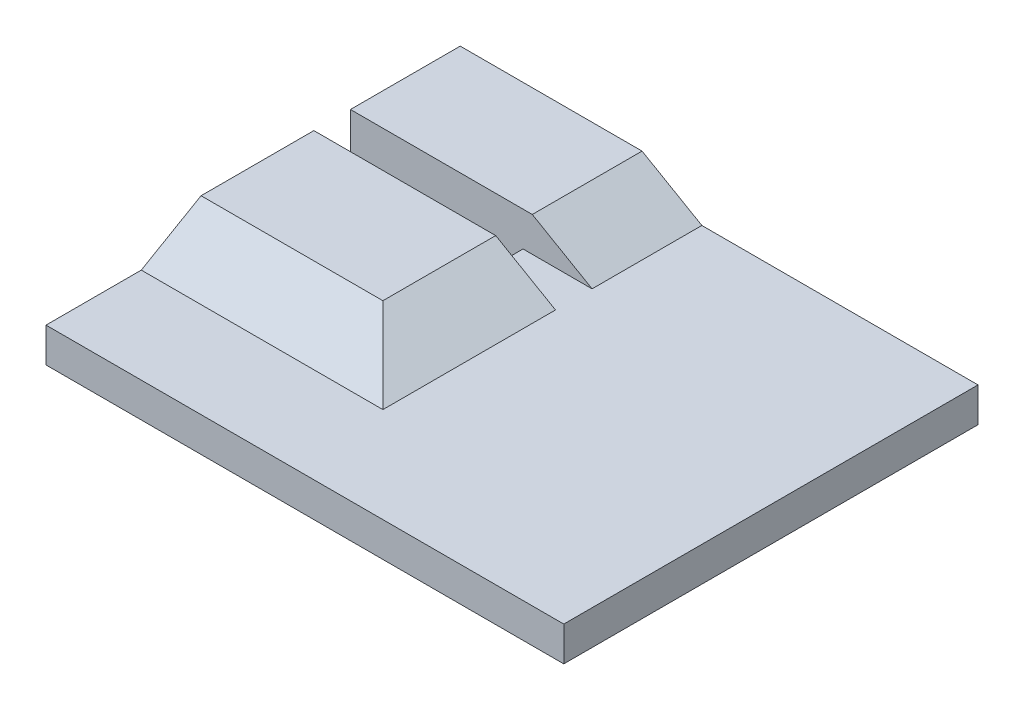
from build123d import *

# Parameters (mm, degrees)
SKETCH1_W           = 37.5
SKETCH1_H           = 40
BOSS_EXTRUDE1_DEPTH = 2.5
SKETCH2_W           = 12.5
SKETCH2_H           = 2.65
CUT_EXTRUDE1_DEPTH  = 28.528394432
SKETCH3_W           = 12.5
SKETCH3_H           = 17.95
SKETCH3_H_2         = 7.5
BOSS_EXTRUDE2_DEPTH = 2.5
SKETCH4_W           = 37.5
SKETCH4_H           = 10
CUT_EXTRUDE2_DEPTH  = 28.866871012


with BuildPart() as part:
    # Sketch1 → Boss-Extrude1 (new body)
    with BuildSketch(Plane(origin=(0, 0, 0), x_dir=(1, 0, 0), z_dir=(0, 1, 0))):
        Rectangle(SKETCH1_W, SKETCH1_H)
    extrude(amount=BOSS_EXTRUDE1_DEPTH)

    # Sketch2 → Cut-Extrude1 (cut, through all)
    with BuildSketch(Plane.XZ):
        with Locations((-12.5, -0.725)):
            Rectangle(SKETCH2_W, SKETCH2_H)
    extrude(amount=-CUT_EXTRUDE1_DEPTH, mode=Mode.SUBTRACT)

    # Sketch3 → Boss-Extrude2 (add)
    with BuildSketch(Plane(origin=(0, 2.5, 0), x_dir=(1, 0, 0), z_dir=(0, 1, 0))):
        with Locations((-12.5, 11.025)):
            Rectangle(SKETCH3_W, SKETCH3_H)
        with Locations((-12.5, -4.35)):
            Rectangle(SKETCH3_W, SKETCH3_H_2)
    extrude(amount=BOSS_EXTRUDE2_DEPTH)

    # Sketch4 → Cut-Extrude2 (cut, through all)
    with BuildSketch(Plane(origin=(0, 5, 0), x_dir=(1, 0, 0), z_dir=(0, 1, 0))):
        with Locations((0, 15)):
            Rectangle(SKETCH4_W, SKETCH4_H)
    extrude(amount=-CUT_EXTRUDE2_DEPTH, mode=Mode.SUBTRACT)

    # Chamfer1
    # the kernel refuses this chamfer: 5, 2.886751346 mm, written as the material it adds along each edge
    with BuildSketch(Plane(origin=(-6.25, 2.5, -2.05), x_dir=(0.9998132206222079, -0.019326765612700723, -1.5830863978385058e-15), z_dir=(0, 0, -1))) as chamfer1_piece_1_section:
        with BuildLine():
            Line((5.174171509, 0), (-0.230896973, -2.982845988))
            Line((-0.230896973, -2.982845988), (-0.330878295, -2.980913312))
            ThreePointArc((-0.330878295, -2.980913312), (-0.128843444, -1.491164065), (-0.099981322, 0.001932677))
            Line((-0.099981322, 0.001932677), (0.001932677, 0.099981322))
            ThreePointArc((0.001932677, 0.099981322), (2.588052093, 0.049990661), (5.176104186, 0.099981322))
            Line((5.176104186, 0.099981322), (5.174171509, 0))
        make_face()
    chamfer1_piece_1 = extrude(amount=7.95, mode=Mode.PRIVATE)
    chamfer1_piece_1 = split(chamfer1_piece_1, bisect_by=Plane(origin=(-6.25, 3.354735535, -6.025), z_dir=(1, 0, 0)), keep=Keep.TOP, mode=Mode.PRIVATE)
    chamfer1_piece_1 = split(chamfer1_piece_1, bisect_by=Plane(origin=(-4.46158964, 5, -6.025), z_dir=(0, -1, 0)), keep=Keep.TOP, mode=Mode.PRIVATE)
    add(chamfer1_piece_1)
    with BuildSketch(Plane(origin=(-6.25, 2.5, 8.1), x_dir=(0, -0.019326765612700723, 0.9998132206222079), z_dir=(-1, 0, 0))) as chamfer1_piece_2_section:
        with BuildLine():
            Line((5.174171509, 0), (-0.230896973, 2.982845988))
            Line((-0.230896973, 2.982845988), (-0.330878295, 2.980913312))
            ThreePointArc((-0.330878295, 2.980913312), (-0.128843444, 1.491164065), (-0.099981322, -0.001932677))
            Line((-0.099981322, -0.001932677), (0.001932677, -0.099981322))
            ThreePointArc((0.001932677, -0.099981322), (2.588052093, -0.049990661), (5.176104186, -0.099981322))
            Line((5.176104186, -0.099981322), (5.174171509, 0))
        make_face()
    chamfer1_piece_2 = extrude(amount=12.5, mode=Mode.PRIVATE)
    chamfer1_piece_2 = split(chamfer1_piece_2, bisect_by=Plane(origin=(-12.5, 5, 9.824344196), z_dir=(0, -1, 0)), keep=Keep.TOP, mode=Mode.PRIVATE)
    add(chamfer1_piece_2)
    with BuildSketch(Plane(origin=(-6.25, 2.5, 0.6), x_dir=(0.9998132206222079, -0.019326765612700723, 0), z_dir=(0, 0, 1))) as chamfer1_piece_3_section:
        with BuildLine():
            Line((5.174171509, 0), (-0.230896973, 2.982845988))
            Line((-0.230896973, 2.982845988), (-0.330878295, 2.980913312))
            ThreePointArc((-0.330878295, 2.980913312), (-0.128843444, 1.491164065), (-0.099981322, -0.001932677))
            Line((-0.099981322, -0.001932677), (0.001932677, -0.099981322))
            ThreePointArc((0.001932677, -0.099981322), (2.588052093, -0.049990661), (5.176104186, -0.099981322))
            Line((5.176104186, -0.099981322), (5.174171509, 0))
        make_face()
    chamfer1_piece_3 = extrude(amount=7.5, mode=Mode.PRIVATE)
    chamfer1_piece_3 = split(chamfer1_piece_3, bisect_by=Plane(origin=(-6.25, 3.354735535, 4.35), z_dir=(1, 0, 0)), keep=Keep.TOP, mode=Mode.PRIVATE)
    chamfer1_piece_3 = split(chamfer1_piece_3, bisect_by=Plane(origin=(-4.46158964, 5, 4.35), z_dir=(0, -1, 0)), keep=Keep.TOP, mode=Mode.PRIVATE)
    add(chamfer1_piece_3)
    with BuildSketch(Plane(origin=(-6.25, 2.5, 0.6), x_dir=(0.9998132206222079, -0.019326765612700723, 0), z_dir=(0, 0, 1))) as chamfer1_piece_4a_section:
        with BuildLine():
            Line((5.174171509, 0), (-0.230896973, 2.982845988))
            Line((-0.230896973, 2.982845988), (-0.330878295, 2.980913312))
            ThreePointArc((-0.330878295, 2.980913312), (-0.128843444, 1.491164065), (-0.099981322, -0.001932677))
            Line((-0.099981322, -0.001932677), (0.001932677, -0.099981322))
            ThreePointArc((0.001932677, -0.099981322), (2.588052093, -0.049990661), (5.176104186, -0.099981322))
            Line((5.176104186, -0.099981322), (5.174171509, 0))
        make_face()
    chamfer1_piece_4a = extrude(amount=20.435428773, mode=Mode.PRIVATE)
    chamfer1_piece_4a = split(chamfer1_piece_4a, bisect_by=Plane(origin=(-4.46158964, 3.354735535, 20), z_dir=(0, 0, -1)), keep=Keep.TOP, mode=Mode.PRIVATE)
    chamfer1_piece_4a = split(chamfer1_piece_4a, bisect_by=Plane(origin=(-6.25, 3.354735535, 14.05), z_dir=(1, 0, 0)), keep=Keep.TOP, mode=Mode.PRIVATE)
    chamfer1_piece_4a = split(chamfer1_piece_4a, bisect_by=Plane(origin=(-4.46158964, 5, 14.05), z_dir=(0, -1, 0)), keep=Keep.TOP, mode=Mode.PRIVATE)
    chamfer1_piece_4a = split(chamfer1_piece_4a, bisect_by=Plane(origin=(-4.46158964, 3.354735535, 8.1), z_dir=(0, 0, 1)), keep=Keep.TOP, mode=Mode.PRIVATE)
    with BuildSketch(Plane(origin=(6.685428773, 2.5, 8.1), x_dir=(0, -0.019326765612700723, 0.9998132206222079), z_dir=(-1, 0, 0))) as chamfer1_piece_4b_section:
        with BuildLine():
            Line((5.174171509, 0), (-0.230896973, 2.982845988))
            Line((-0.230896973, 2.982845988), (-0.330878295, 2.980913312))
            ThreePointArc((-0.330878295, 2.980913312), (-0.128843444, 1.491164065), (-0.099981322, -0.001932677))
            Line((-0.099981322, -0.001932677), (0.001932677, -0.099981322))
            ThreePointArc((0.001932677, -0.099981322), (2.588052093, -0.049990661), (5.176104186, -0.099981322))
            Line((5.176104186, -0.099981322), (5.174171509, 0))
        make_face()
    chamfer1_piece_4b = extrude(amount=25.435428773, mode=Mode.PRIVATE)
    chamfer1_piece_4b = split(chamfer1_piece_4b, bisect_by=Plane(origin=(0.217714387, 5, 9.824344196), z_dir=(0, -1, 0)), keep=Keep.TOP, mode=Mode.PRIVATE)
    chamfer1_piece_4b = split(chamfer1_piece_4b, bisect_by=Plane(origin=(-6.25, 3.374002547, 9.824344196), z_dir=(1, 0, 0)), keep=Keep.TOP, mode=Mode.PRIVATE)
    chamfer1_piece_4 = chamfer1_piece_4a & chamfer1_piece_4b
    add(chamfer1_piece_4)


solid = part.part
